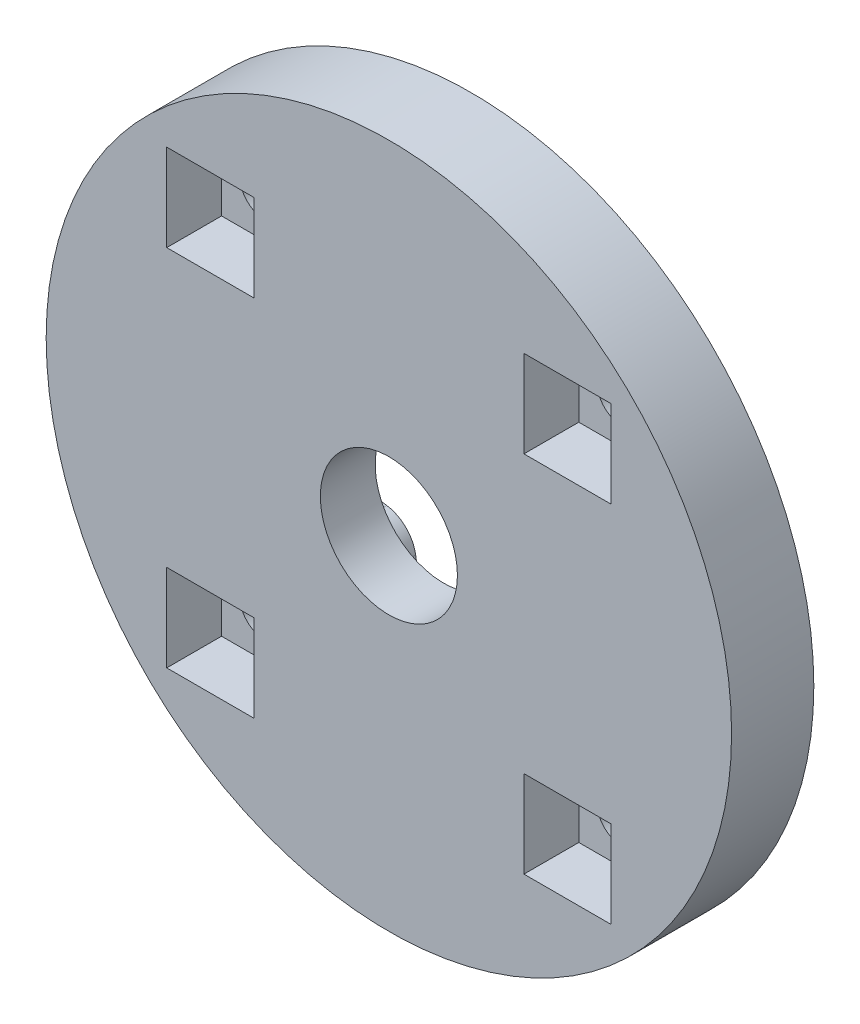
from build123d import *

# Parameters (mm, degrees)
BOSS_EXTRUDE1_OUTLINE_R = 25
BOSS_EXTRUDE1_DEPTH     = 2
SKETCH4_R               = 25
SKETCH4_R_2             = 5
BOSS_EXTRUDE2_DEPTH     = 4
SKETCH5_R               = 1.85
CUT_EXTRUDE1_DEPTH      = 36.860842154
SKETCH6_R               = 3
CUT_EXTRUDE2_DEPTH      = 4
SKETCH7_W               = 6.35
SKETCH7_H               = 6.35
CUT_EXTRUDE3_DEPTH      = 4


# Read off the part's stored shape, not the designer's step: Boss-Extrude1
with BuildPart() as part:
    # Boss-Extrude1 outline → Boss-Extrude1 (new body)
    with BuildSketch(Plane.XY):
        Circle(BOSS_EXTRUDE1_OUTLINE_R)
        with BuildLine():
            ThreePointArc((4.047481829, 6.234173406), (4.763543773, 4.853224592), (6.157606479, 4.163040916))
            Line((6.157606479, 4.163040916), (17.857142857, 2.474358297))
            ThreePointArc((17.857142857, 2.474358297), (20, 0), (17.857142857, -2.474358297))
            Line((17.857142857, -2.474358297), (6.157606479, -4.163040916))
            ThreePointArc((6.157606479, -4.163040916), (4.763543773, -4.853224592), (4.047481829, -6.234173406))
            Line((4.047481829, -6.234173406), (2.467267507, -15.903225806))
            ThreePointArc((2.467267507, -15.903225806), (0, -18), (-2.467267507, -15.903225806))
            Line((-2.467267507, -15.903225806), (-4.047481829, -6.234173406))
            ThreePointArc((-4.047481829, -6.234173406), (-4.763543773, -4.853224592), (-6.157606479, -4.163040916))
            Line((-6.157606479, -4.163040916), (-17.857142857, -2.474358297))
            ThreePointArc((-17.857142857, -2.474358297), (-20, 0), (-17.857142857, 2.474358297))
            Line((-17.857142857, 2.474358297), (-6.157606479, 4.163040916))
            ThreePointArc((-6.157606479, 4.163040916), (-4.763543773, 4.853224592), (-4.047481829, 6.234173406))
            Line((-4.047481829, 6.234173406), (-2.467267507, 15.903225806))
            ThreePointArc((-2.467267507, 15.903225806), (0, 18), (2.467267507, 15.903225806))
            Line((2.467267507, 15.903225806), (4.047481829, 6.234173406))
        make_face(mode=Mode.SUBTRACT)
    extrude(amount=BOSS_EXTRUDE1_DEPTH)

    # Sketch4 → Boss-Extrude2 (add)
    with BuildSketch(Plane.XY.offset(2)):
        Circle(SKETCH4_R)
        Circle(SKETCH4_R_2, mode=Mode.SUBTRACT)
    extrude(amount=BOSS_EXTRUDE2_DEPTH)

    # Sketch5 → Cut-Extrude1 (cut, through all)
    with BuildSketch(Plane.XY.offset(6)):
        with Locations((13.029498672, 13.274798425)):
            Circle(SKETCH5_R)
        with Locations((-13.029498672, 13.274798425)):
            Circle(SKETCH5_R)
        with Locations((-13.029498672, -13.274798425)):
            Circle(SKETCH5_R)
        with Locations((13.029498672, -13.274798425)):
            Circle(SKETCH5_R)
    extrude(amount=-CUT_EXTRUDE1_DEPTH, mode=Mode.SUBTRACT)

    # Sketch6 → Cut-Extrude2 (cut)
    with BuildSketch(Plane.XY.offset(6)):
        with Locations((-13.029498672, -13.274798425)):
            Circle(SKETCH6_R)
        with Locations((13.029498672, -13.274798425)):
            Circle(SKETCH6_R)
        with Locations((13.029498672, 13.274798425)):
            Circle(SKETCH6_R)
        with Locations((-13.029498672, 13.274798425)):
            Circle(SKETCH6_R)
    extrude(amount=-CUT_EXTRUDE2_DEPTH, mode=Mode.SUBTRACT)

    # Sketch7 → Cut-Extrude3 (cut)
    with BuildSketch(Plane.XY.offset(6)):
        with Locations((13.029498672, 13.274798425)):
            Rectangle(SKETCH7_W, SKETCH7_H)
        with Locations((13.029498672, -13.274798425)):
            Rectangle(SKETCH7_W, SKETCH7_H)
        with Locations((-13.029498672, -13.274798425)):
            Rectangle(SKETCH7_W, SKETCH7_H)
        with Locations((-13.029498672, 13.274798425)):
            Rectangle(SKETCH7_W, SKETCH7_H)
    extrude(amount=-CUT_EXTRUDE3_DEPTH, mode=Mode.SUBTRACT)


solid = part.part
